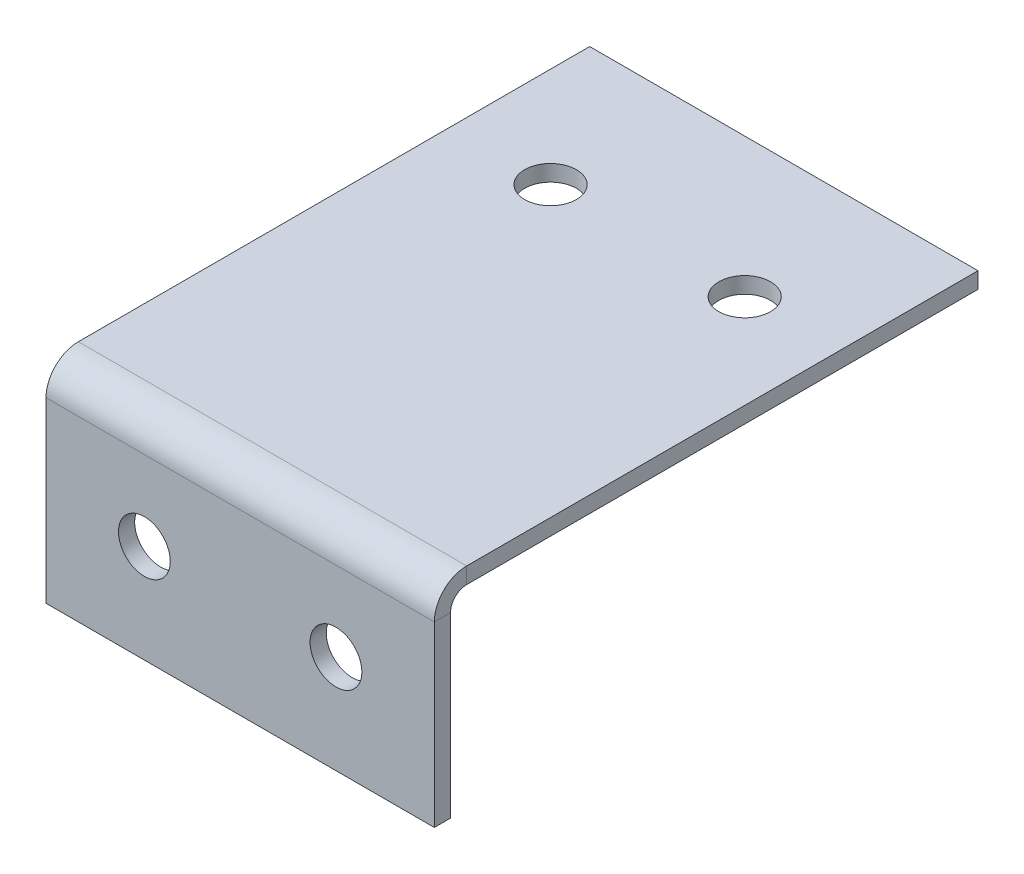
from build123d import *

# Parameters (mm, degrees)
SKETCH1_W                    = 38.1
SKETCH1_H                    = 53.34
BOSS_EXTRUDE1_DEPTH          = 1.5875
EDGE_FLANGE1_STRIP_W         = 9.525
EDGE_FLANGE1_STRIP_H         = 1.5875
EDGE_FLANGE1_STRIP_CUT_DEPTH = 38.1
EDGE_FLANGE1_DEPTH           = 38.1
CUT_EXTRUDE1_REACH           = 40.731
SKETCH9_R                    = 2.54
CUT_EXTRUDE2_REACH           = 61.758
SKETCH11_R                   = 2.54


# Sheet-metal steps are written as plain solids
with BuildPart() as part:
    # Sketch1 → Boss-Extrude1 (new body)
    with BuildSketch(Plane(origin=(0, 0, 0), x_dir=(1, 0, 0), z_dir=(0, 1, 0))):
        Rectangle(SKETCH1_W, SKETCH1_H)
    extrude(amount=BOSS_EXTRUDE1_DEPTH)

    # Edge-Flange1 strip (across the edge) → Edge-Flange1 strip cut (cut)
    with BuildSketch(Plane(origin=(19.05, 0, 26.67), x_dir=(0, 0, -1), z_dir=(-1, 0, 0))):
        with Locations((-1.5875, -0.79375)):
            Rectangle(EDGE_FLANGE1_STRIP_W, EDGE_FLANGE1_STRIP_H)
    extrude(amount=EDGE_FLANGE1_STRIP_CUT_DEPTH, mode=Mode.SUBTRACT)

    # Edge-Flange1 section (across the edge) → Edge-Flange1 (add)
    with BuildSketch(Plane(origin=(19.05, 0, 26.67), x_dir=(0, 0, -1), z_dir=(-1, 0, 0))):
        with BuildLine():
            Line((0, 1.5875), (0, 19.05))
            Line((0, 19.05), (1.5875, 19.05))
            Line((1.5875, 19.05), (1.5875, 1.5875))
            ThreePointArc((1.5875, 1.5875), (2.052467985, 0.464967985), (3.175, 0))
            Line((3.175, 0), (3.175, -1.5875))
            ThreePointArc((3.175, -1.5875), (0.92993597, -0.65756403), (0, 1.5875))
        make_face()
    extrude(amount=EDGE_FLANGE1_DEPTH)

    # Sketch9 → Cut-Extrude1 (cut, up to next)
    with BuildSketch(Plane(origin=(0, 1.5875, 0), x_dir=(1, 0, 0), z_dir=(0, 1, 0)), mode=Mode.PRIVATE) as cut_extrude1_sk1:
        with Locations(Location((9.813099354, 13.0175, 0), (0, 0, 270))):
            Circle(SKETCH9_R)
    cut_extrude1_tool1 = extrude(cut_extrude1_sk1.sketch, amount=-CUT_EXTRUDE1_REACH, mode=Mode.PRIVATE) & part.part
    # Sketch9 → Cut-Extrude1 (cut, up to next)
    with BuildSketch(Plane(origin=(0, 1.5875, 0), x_dir=(1, 0, 0), z_dir=(0, 1, 0)), mode=Mode.PRIVATE) as cut_extrude1_sk2:
        with Locations(Location((-9.236900646, 13.0175, 0), (0, 0, 270))):
            Circle(SKETCH9_R)
    cut_extrude1_tool2 = extrude(cut_extrude1_sk2.sketch, amount=-CUT_EXTRUDE1_REACH, mode=Mode.PRIVATE) & part.part
    add(cut_extrude1_tool1.solids().sort_by_distance((9.813099, 1.5875, -13.0175))[0], mode=Mode.SUBTRACT)
    add(cut_extrude1_tool2.solids().sort_by_distance((-9.236901, 1.5875, -13.0175))[0], mode=Mode.SUBTRACT)

    # Sketch11 → Cut-Extrude2 (cut, up to next)
    with BuildSketch(Plane.XY.offset(26.67), mode=Mode.PRIVATE) as cut_extrude2_sk1:
        with Locations((-9.398, -9.398)):
            Circle(SKETCH11_R)
    cut_extrude2_tool1 = extrude(cut_extrude2_sk1.sketch, amount=-CUT_EXTRUDE2_REACH, mode=Mode.PRIVATE) & part.part
    # Sketch11 → Cut-Extrude2 (cut, up to next)
    with BuildSketch(Plane.XY.offset(26.67), mode=Mode.PRIVATE) as cut_extrude2_sk2:
        with Locations((9.398, -9.398)):
            Circle(SKETCH11_R)
    cut_extrude2_tool2 = extrude(cut_extrude2_sk2.sketch, amount=-CUT_EXTRUDE2_REACH, mode=Mode.PRIVATE) & part.part
    add(cut_extrude2_tool1.solids().sort_by_distance((-9.398, -9.398, 26.67))[0], mode=Mode.SUBTRACT)
    add(cut_extrude2_tool2.solids().sort_by_distance((9.398, -9.398, 26.67))[0], mode=Mode.SUBTRACT)


solid = part.part
